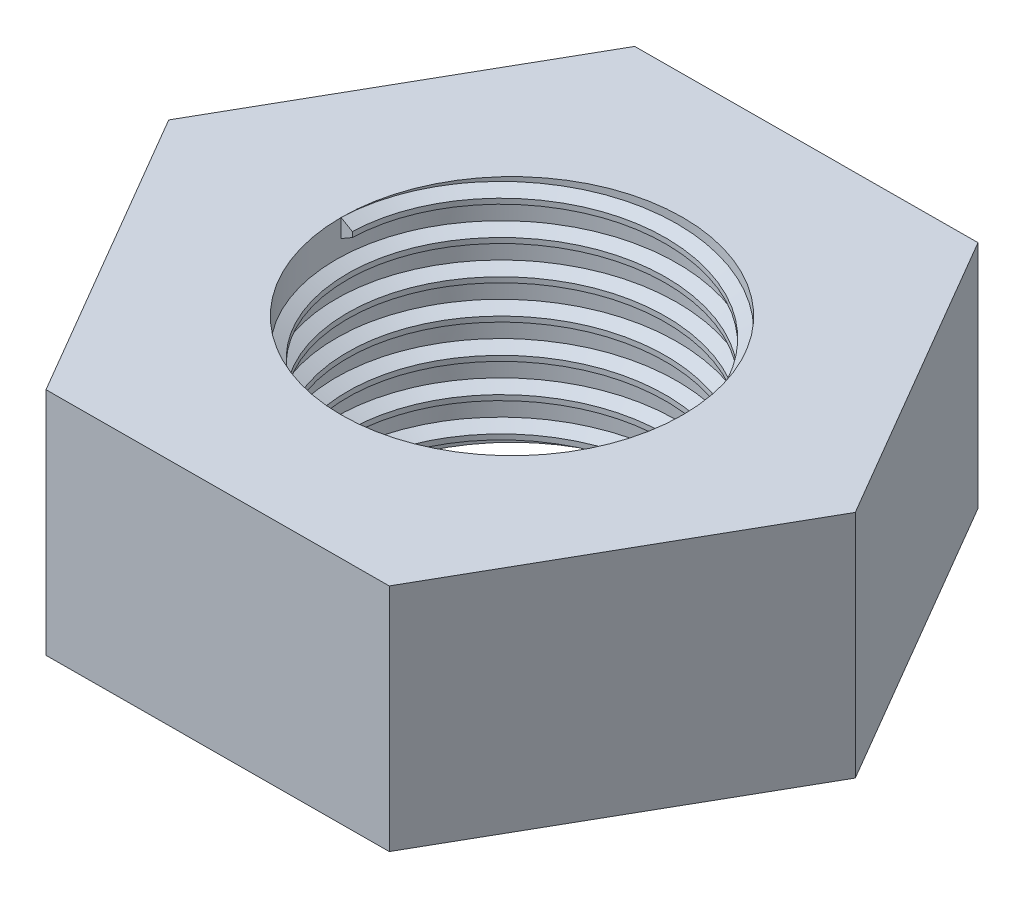
from build123d import *
from build123d.topology import SkipClean

# Parameters (mm, degrees)
BOSS_EXTRUDE1_DEPTH = 3.5
CUT_EXTRUDE1_REACH  = 9.721
SKETCH2_R           = 2.6
THREAD1_PITCH       = 0.5175


with BuildPart() as part:
    # Sketch1 → Boss-Extrude1 (new body)
    with BuildSketch(Plane(origin=(0, 0, 0), x_dir=(1, 0, 0), z_dir=(0, 1, 0))):
        Polygon((2.575794089, 4.512791244), (-2.620294815, 4.487098738), (-5.196088904, -0.025692506), (-2.575794089, -4.512791244), (2.620294815, -4.487098738), (5.196088904, 0.025692506), align=None)
    extrude(amount=BOSS_EXTRUDE1_DEPTH)

    # Sketch2 → Cut-Extrude1 (cut, up to next)
    with BuildSketch(Plane(origin=(0, 3.5, 0), x_dir=(1, 0, 0), z_dir=(0, 1, 0)), mode=Mode.PRIVATE) as cut_extrude1_sk1:
        with Locations(Location((0, 0, 0), (0, 0, 270))):
            Circle(SKETCH2_R)
    cut_extrude1_tool1 = extrude(cut_extrude1_sk1.sketch, amount=-CUT_EXTRUDE1_REACH, mode=Mode.PRIVATE) & part.part
    add(cut_extrude1_tool1.solids().sort_by_distance((0, 3.5, 0))[0], mode=Mode.SUBTRACT)

    # Thread1: the profile of Thread Profile1 profile screwed along a right-hand helix of 6.763285 turns, 6 arcs to a turn; built about Z, then put on its axis
    with SkipClean():  # the faces are left unmerged after this step: merging them gives an invalid solid
        thread1_z = Axis((0, 0, 0), (0, 0, 1))
        thread1_corners = [(2.6003, 0, -0.000173205), (2.6003, 0, 0.277985704), (2.428148085, 0, 0.17859375), (2.428148085, 0, 0.09921875)]
        with BuildLine(mode=Mode.PRIVATE) as thread1_profile:
            Line(thread1_corners[0], thread1_corners[1])
            Line(thread1_corners[1], thread1_corners[2])
            Line(thread1_corners[2], thread1_corners[3])
            Line(thread1_corners[3], thread1_corners[0])
        thread1_cap = Face(thread1_profile.wire())
        thread1_turn_angles = [0, 30, 60, 90, 120, 150, 180, 210, 240, 270, 300, 330, 360]
        thread1_turn_weights = [1, 0.8660254037844387, 1, 0.8660254037844387, 1, 0.8660254037844387, 1, 0.8660254037844387, 1, 0.8660254037844387, 1, 0.8660254037844387, 1]
        thread1_turn_rails = [Edge.make_bspline([Vector(p[0], p[1], 0).rotate(thread1_z, thread1_turn_angles[k]) / thread1_turn_weights[k] + Vector(0, 0, p[2] + THREAD1_PITCH * thread1_turn_angles[k] / 360) for k in range(13)], [0, 0, 0, 1, 1, 2, 2, 3, 3, 4, 4, 5, 5, 6, 6, 6], 2, thread1_turn_weights) for p in thread1_corners]
        thread1_turn_sides = [Face.make_surface_from_curves(thread1_turn_rails[p[0]], thread1_turn_rails[p[1]]) for p in [(0, 1), (1, 2), (2, 3), (3, 0)]]
        thread1_last_angles = [2160, 2190, 2220, 2250, 2280, 2310, 2340, 2370, 2400, 2417.391304348, 2434.782608696]
        thread1_last_weights = [1, 0.8660254037844387, 1, 0.8660254037844387, 1, 0.8660254037844387, 1, 0.8660254037844387, 1, 0.9542857022778781, 1]
        thread1_last_rails = [Edge.make_bspline([Vector(p[0], p[1], 0).rotate(thread1_z, thread1_last_angles[k]) / thread1_last_weights[k] + Vector(0, 0, p[2] + THREAD1_PITCH * thread1_last_angles[k] / 360) for k in range(11)], [0, 0, 0, 1, 1, 2, 2, 3, 3, 4, 4, 5, 5, 5], 2, thread1_last_weights) for p in thread1_corners]
        thread1_last_sides = [Face.make_surface_from_curves(thread1_last_rails[p[0]], thread1_last_rails[p[1]]) for p in [(0, 1), (1, 2), (2, 3), (3, 0)]]
        thread1 = Plane(origin=(0, 3.5, 0), x_dir=(-1, 0, 0), z_dir=(0, -1, 0)) * Solid(Shell([*[p.moved(Location((0, 0, THREAD1_PITCH * i))) for i in range(6) for p in thread1_turn_sides], *thread1_last_sides, thread1_cap, thread1_cap.rotate(thread1_z, 2434.782608696).moved(Location((0, 0, THREAD1_PITCH * 2434.782608696 / 360)))]))
        add(thread1)


solid = part.part
